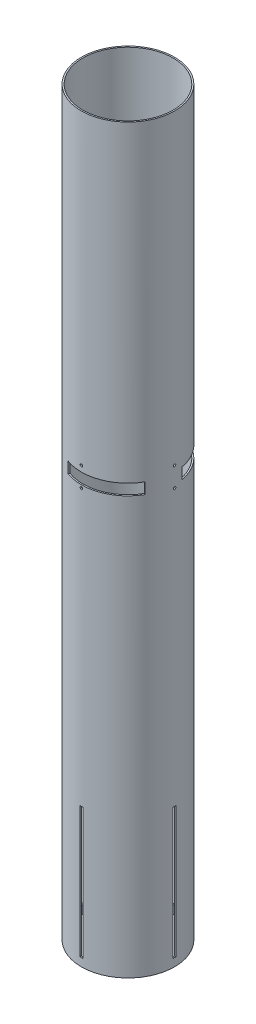
from build123d import *

# Parameters (mm, degrees)
SKETCH1_R              = 51.1048
SKETCH1_R_2            = 49.53
BOSS_EXTRUDE1_DEPTH    = 812.8
CUT_EXTRUDE1_DEPTH     = 817.00688794
CIRPATTERN1_COUNT      = 4
CUT_EXTRUDE2_DEPTH     = 817.00688794
CIRPATTERN2_COUNT      = 4
SKETCH3_R              = 3.175
CUT_EXTRUDE3_DEPTH     = 817.006888053
CUT_EXTRUDE4_START     = -12.065
CUT_EXTRUDE4_DEPTH     = 12.065
CIRPATTERN3_COUNT      = 3
LPATTERN1_COPY_1_DEPTH = 817.00688794
LPATTERN1_COPY_2_DEPTH = 817.00688794
LPATTERN1_COPY_3_DEPTH = 817.00688794
LPATTERN1_COPY_4_DEPTH = 817.00688794


with BuildPart() as part:
    # Sketch1 → Boss-Extrude1 (new body)
    with BuildSketch(Plane(origin=(0, 0, 0), x_dir=(1, 0, 0), z_dir=(0, 1, 0))):
        Circle(SKETCH1_R)
        Circle(SKETCH1_R_2, mode=Mode.SUBTRACT)
    extrude(amount=BOSS_EXTRUDE1_DEPTH)

    # Sketch2 → Cut-Extrude1 (cut, through all)
    with BuildSketch(Plane(origin=(0, 0, 0), x_dir=(0, 0, -1), z_dir=(1, 0, 0))):
        Polygon((0, 8.89), (1.5875, 8.89), (1.5875, 152.4), (-1.5875, 152.4), (-1.5875, 8.89), align=None)
    cut_extrude1 = extrude(amount=-CUT_EXTRUDE1_DEPTH, mode=Mode.SUBTRACT)

    # CirPattern1: Cut-Extrude1 ×4 about axis
    cirpattern1_axis = Axis((0, 0, 0), (0, 1, 0))
    for i in range(1, CIRPATTERN1_COUNT):
        add(cut_extrude1.rotate(cirpattern1_axis, i * 360 / CIRPATTERN1_COUNT), mode=Mode.SUBTRACT)

    # Sketch2<3> → Cut-Extrude2 (cut, through all)
    with BuildSketch(Plane(origin=(0, 0, 0), x_dir=(0, 0, -1), z_dir=(1, 0, 0))):
        with BuildLine():
            ThreePointArc((0, 477.60255), (-0.956397277, 475.293602723), (1.35255, 476.25))
            ThreePointArc((1.35255, 476.25), (0.956397277, 477.206397277), (0, 477.60255))
        make_face()
    cut_extrude2 = extrude(amount=-CUT_EXTRUDE2_DEPTH, mode=Mode.SUBTRACT)

    # CirPattern2: Cut-Extrude2 ×4 about axis
    cirpattern2_axis = Axis((0, 812.8, 0), (0, -1, 0))
    for i in range(1, CIRPATTERN2_COUNT):
        add(cut_extrude2.rotate(cirpattern2_axis, i * 360 / CIRPATTERN2_COUNT), mode=Mode.SUBTRACT)

    # Sketch3 → Cut-Extrude3 (cut, through all)
    with BuildSketch(Plane(origin=(0, 0, 0), x_dir=(0.7071067811865477, 0, -0.7071067811865475), z_dir=(0.7071067811865475, 0, 0.7071067811865477))):
        with Locations((0, 127)):
            Circle(SKETCH3_R)
    extrude(amount=-CUT_EXTRUDE3_DEPTH, mode=Mode.SUBTRACT)

    # Sketch7 → Cut-Extrude4 (cut)
    with BuildSketch(Plane(origin=(0, 469.9, 0), x_dir=(1, 0, 0), z_dir=(0, 1, 0)).offset(CUT_EXTRUDE4_START)):
        with BuildLine():
            Line((-44.258055055, -25.5524), (-42.894238249, -24.765))
            ThreePointArc((-42.894238249, -24.765), (-48.777528007, 8.60079424), (-31.837270308, 37.942181268))
            Line((-31.837270308, 37.942181268), (-32.849532236, 39.148548057))
            ThreePointArc((-32.849532236, 39.148548057), (-46.026790738, 22.208897258), (-51.086898433, 1.35255))
            ThreePointArc((-51.086898433, 1.35255), (-51.1048, 0), (-51.086898433, -1.35255))
            ThreePointArc((-51.086898433, -1.35255), (-49.184074902, -13.87902587), (-44.258055055, -25.5524))
        make_face()
    cut_extrude4 = extrude(amount=CUT_EXTRUDE4_DEPTH, mode=Mode.SUBTRACT)

    # CirPattern3: Cut-Extrude4 ×3 about axis
    cirpattern3_axis = Axis((0, 812.8, 0), (0, -1, 0))
    for i in range(1, CIRPATTERN3_COUNT):
        add(cut_extrude4.rotate(cirpattern3_axis, i * 360 / CIRPATTERN3_COUNT), mode=Mode.SUBTRACT)

    # LPattern1 copy 1 sketch → LPattern1 copy 1 (cut, through all)
    with BuildSketch(Plane(origin=(0, -21.6916, 0), x_dir=(1, 0, 0), z_dir=(0, 0, 1))):
        with BuildLine():
            ThreePointArc((0, 477.60255), (-0.956397277, 475.293602723), (1.35255, 476.25))
            ThreePointArc((1.35255, 476.25), (0.956397277, 477.206397277), (0, 477.60255))
        make_face()
    extrude(amount=-LPATTERN1_COPY_1_DEPTH, mode=Mode.SUBTRACT)

    # LPattern1 copy 2 sketch → LPattern1 copy 2 (cut, through all)
    with BuildSketch(Plane(origin=(0, -21.6916, 0), x_dir=(0, 0, 1), z_dir=(-1, 0, 0))):
        with BuildLine():
            ThreePointArc((0, 477.60255), (-0.956397277, 475.293602723), (1.35255, 476.25))
            ThreePointArc((1.35255, 476.25), (0.956397277, 477.206397277), (0, 477.60255))
        make_face()
    extrude(amount=-LPATTERN1_COPY_2_DEPTH, mode=Mode.SUBTRACT)

    # LPattern1 copy 3 sketch → LPattern1 copy 3 (cut, through all)
    with BuildSketch(Plane(origin=(0, -21.6916, 0), x_dir=(-1, 0, 0), z_dir=(0, 0, -1))):
        with BuildLine():
            ThreePointArc((0, 477.60255), (-0.956397277, 475.293602723), (1.35255, 476.25))
            ThreePointArc((1.35255, 476.25), (0.956397277, 477.206397277), (0, 477.60255))
        make_face()
    extrude(amount=-LPATTERN1_COPY_3_DEPTH, mode=Mode.SUBTRACT)

    # LPattern1 copy 4 sketch → LPattern1 copy 4 (cut, through all)
    with BuildSketch(Plane(origin=(0, -21.6916, 0), x_dir=(0, 0, -1), z_dir=(1, 0, 0))):
        with BuildLine():
            ThreePointArc((0, 477.60255), (-0.956397277, 475.293602723), (1.35255, 476.25))
            ThreePointArc((1.35255, 476.25), (0.956397277, 477.206397277), (0, 477.60255))
        make_face()
    extrude(amount=-LPATTERN1_COPY_4_DEPTH, mode=Mode.SUBTRACT)


solid = part.part
